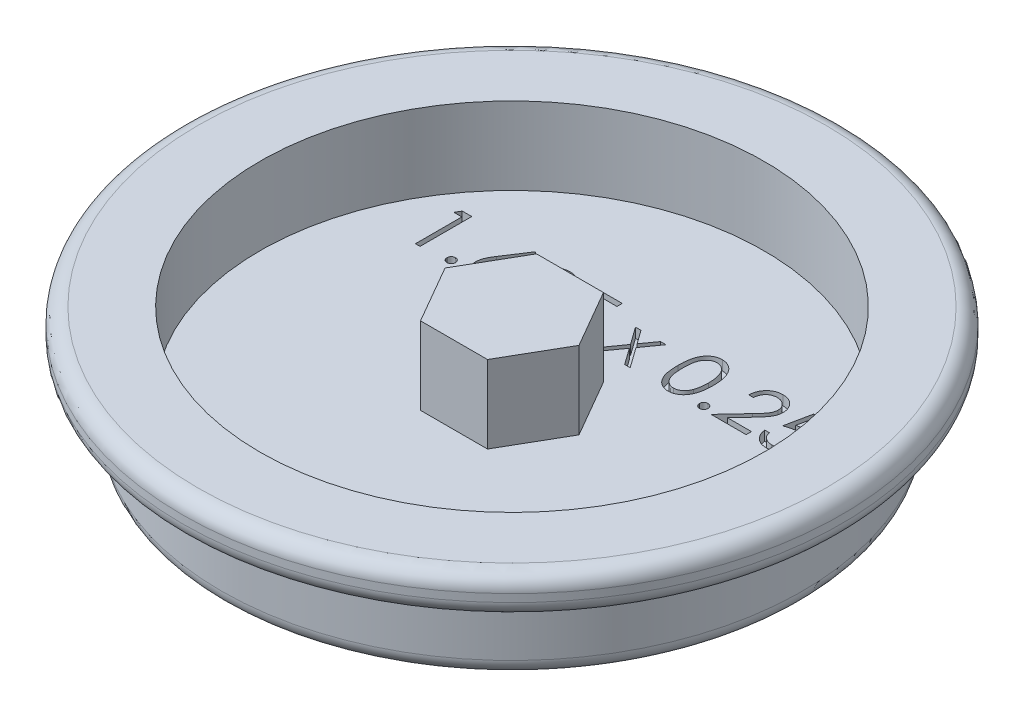
from build123d import *

# Parameters (mm, degrees)
BOSS_EXTRUDE1_DEPTH = 6.35
CUT_EXTRUDE1_DEPTH  = 0.79375


with BuildPart() as part:
    # Sketch1 → Revolve1 (revolve)
    with BuildSketch(Plane.XY):
        with BuildLine():
            Line((0, 0), (22.5425, 0))
            ThreePointArc((22.5425, 0), (23.440525612, 0.371974388), (23.8125, 1.27))
            Line((23.8125, 1.27), (23.8125, 5.08))
            ThreePointArc((23.8125, 5.08), (24.184474388, 5.978025612), (25.0825, 6.35))
            Line((25.0825, 6.35), (25.7175, 6.35))
            ThreePointArc((25.7175, 6.35), (26.615525612, 6.721974388), (26.9875, 7.62))
            Line((26.9875, 7.62), (26.9875, 8.255))
            ThreePointArc((26.9875, 8.255), (26.615525612, 9.153025612), (25.7175, 9.525))
            Line((25.7175, 9.525), (20.6375, 9.525))
            Line((20.6375, 9.525), (20.6375, 3.175))
            Line((20.6375, 3.175), (0, 3.175))
            Line((0, 3.175), (0, 0))
        make_face()
    revolve(axis=Axis((0, 3.175, 0), (0, -1, 0)))

    # Sketch2 → Boss-Extrude1 (add)
    with BuildSketch(Plane(origin=(0, 3.175, 0), x_dir=(1, 0, 0), z_dir=(0, 1, 0))):
        Polygon((2.742298309, 4.7498), (-2.742298309, 4.7498), (-5.484596617, 0), (-2.742298309, -4.7498), (2.742298309, -4.7498), (5.484596617, 0), align=None)
    extrude(amount=BOSS_EXTRUDE1_DEPTH)

    # Sketch3 → Cut-Extrude1 (cut)
    # profile 1 of 10: a face of its own
    with BuildSketch(Plane(origin=(0, 3.175, 0), x_dir=(1, 0, 0), z_dir=(0, 1, 0))):
        Polygon((-15.172196678, 11.095518737), (-14.389470984, 11.095518737), (-14.389470984, 6.862185403), (-14.769385514, 6.862185403), (-14.769385514, 10.661330703), (-15.420667565, 10.661330703), align=None)
    # profile 2 of 10: a face of its own
    with BuildSketch(Plane(origin=(0, 3.175, 0), x_dir=(1, 0, 0), z_dir=(0, 1, 0))):
        with BuildLine():
            add(Edge.make_bspline(
                [(-12.137120557, 7.513467455), (-12.113546681, 7.512066624), (-12.067332854, 7.509320461), (-12.000519813, 7.490480103), (-11.940050081, 7.457026295), (-11.886187271, 7.412439886), (-11.841789914, 7.358379418), (-11.807143888, 7.298391985), (-11.788467649, 7.231019583), (-11.785741489, 7.184537976), (-11.784342779, 7.160689677)],
                knots=[0, 0, 0, 0, 1.020151414, 1.999887582, 2.974338812, 3.990962822, 5.007586832, 5.987933904, 6.967670073, 8, 8, 8, 8], degree=3))
            add(Edge.make_bspline(
                [(-11.784342779, 7.160689677), (-11.785788886, 7.137414411), (-11.788640589, 7.09151593), (-11.807101077, 7.024651684), (-11.842053957, 6.964626762), (-11.885881044, 6.909832747), (-11.940063397, 6.865151885), (-12.000662773, 6.831982696), (-12.067176009, 6.811793349), (-12.113520514, 6.809221542), (-12.137120557, 6.807911899)],
                knots=[0, 0, 0, 0, 1.009421747, 1.99056486, 2.972319754, 3.999869655, 5.017953583, 5.993804169, 6.978383603, 8, 8, 8, 8], degree=3))
            add(Edge.make_bspline(
                [(-12.137120557, 6.807911899), (-12.160737604, 6.809174155), (-12.206844268, 6.811638408), (-12.273109233, 6.832397231), (-12.334077661, 6.864840845), (-12.388249465, 6.909916059), (-12.432443616, 6.964344804), (-12.465857175, 7.025065072), (-12.485923355, 7.091324525), (-12.488562382, 7.137376712), (-12.489898334, 7.160689677)],
                knots=[0, 0, 0, 0, 1.022052826, 1.995314843, 2.982371812, 4.00089066, 5.028879526, 6.005146991, 6.990147033, 8, 8, 8, 8], degree=3))
            add(Edge.make_bspline(
                [(-12.489898334, 7.160689677), (-12.4886137, 7.184577022), (-12.486105609, 7.231214131), (-12.465815049, 7.297978766), (-12.432702868, 7.358658688), (-12.387943962, 7.412357408), (-12.334090766, 7.457336336), (-12.273256308, 7.490071848), (-12.206684674, 7.509473109), (-12.160710749, 7.512112914), (-12.137120557, 7.513467455)],
                knots=[0, 0, 0, 0, 1.032775665, 2.016367738, 2.991239715, 4.008302682, 5.025365648, 6.011011707, 6.979408107, 8, 8, 8, 8], degree=3))
        make_face()
    # profile 3 of 10: a face of its own
    with BuildSketch(Plane(origin=(0, 3.175, 0), x_dir=(1, 0, 0), z_dir=(0, 1, 0))):
        with BuildLine():
            Line((-9.287761582, 11.204065745), (-8.995193473, 10.974251376))
            Line((-8.995193473, 10.974251376), (-10.113736475, 9.263787967))
            add(Edge.make_bspline(
                [(-10.113736475, 9.263787967), (-10.039265759, 9.275658066), (-9.894002208, 9.298812034), (-9.746965359, 9.302631644), (-9.675308324, 9.304493096)],
                knots=[0, 0, 0, 0, 1.025318673, 2, 2, 2, 2], degree=3))
            add(Edge.make_bspline(
                [(-9.675308324, 9.304493096), (-9.632282542, 9.303336656), (-9.547587572, 9.301060238), (-9.423240297, 9.283541676), (-9.303752727, 9.25593416), (-9.18962011, 9.215690574), (-9.080432789, 9.164282964), (-8.975564177, 9.102671188), (-8.876985555, 9.027673841), (-8.783427462, 8.943896228), (-8.698486116, 8.851105209), (-8.623282696, 8.752648354), (-8.560113148, 8.648628241), (-8.508860881, 8.539097555), (-8.469061647, 8.424225137), (-8.440048019, 8.304157958), (-8.422897464, 8.178813226), (-8.420568537, 8.093568195), (-8.419385514, 8.050266333)],
                knots=[0, 0, 0, 0, 1.04369286, 2.054478336, 3.041073146, 4.015093852, 4.984733326, 5.965804835, 6.960378782, 7.985147595, 9.009457201, 10.008161701, 10.986880575, 11.956520048, 12.937015923, 13.931873656, 14.949455224, 16, 16, 16, 16], degree=3))
            add(Edge.make_bspline(
                [(-8.419385514, 8.050266333), (-8.421106793, 7.991024215), (-8.424493863, 7.874449746), (-8.458244169, 7.704660778), (-8.510688692, 7.542908116), (-8.585651988, 7.39177428), (-8.678764013, 7.25146641), (-8.792311197, 7.127144943), (-8.922266654, 7.01626785), (-9.069207829, 6.923549844), (-9.227344557, 6.847829963), (-9.393475068, 6.793443432), (-9.565985997, 6.759959617), (-9.683073476, 6.75576184), (-9.74230218, 6.753638395)],
                knots=[0, 0, 0, 0, 1.031375318, 2.029502543, 3.004789286, 3.987476834, 4.960371455, 5.9300674, 6.912260825, 7.929083631, 8.949397511, 9.960523116, 10.96833055, 12, 12, 12, 12], degree=3))
            add(Edge.make_bspline(
                [(-9.74230218, 6.753638395), (-9.799266761, 6.755486796), (-9.912103622, 6.759148155), (-10.078089954, 6.791764099), (-10.237581413, 6.844628881), (-10.389460569, 6.917459484), (-10.53015312, 7.009453305), (-10.656022985, 7.120200061), (-10.76644256, 7.247332462), (-10.858335673, 7.390830787), (-10.931220044, 7.545032926), (-10.985878334, 7.705823582), (-11.017805219, 7.872616893), (-11.022266616, 7.985684556), (-11.024513719, 8.042634121)],
                knots=[0, 0, 0, 0, 1.012016664, 2.004627821, 2.994792927, 3.992885782, 4.990978636, 5.973936114, 6.964471063, 7.975201453, 8.993600317, 9.990122807, 10.98767138, 12, 12, 12, 12], degree=3))
            add(Edge.make_bspline(
                [(-11.024513719, 8.042634121), (-11.023084733, 8.086230903), (-11.020167017, 8.175247201), (-10.999794535, 8.310065597), (-10.967059022, 8.448013096), (-10.930398057, 8.565039596), (-10.891662319, 8.660908294), (-10.859425438, 8.738201088), (-10.8193007, 8.817740672), (-10.776515753, 8.902254498), (-10.72721935, 8.989564498), (-10.673618517, 9.081129888), (-10.61423132, 9.175494429), (-10.572599313, 9.239531694), (-10.551316604, 9.272268203)],
                knots=[0, 0, 0, 0, 1.173818275, 2.396712641, 3.66331629, 4.989737886, 5.693666774, 6.447286557, 7.243889047, 8.091586357, 8.998013824, 9.943181721, 10.948533338, 12, 12, 12, 12], degree=3))
            Line((-10.551316604, 9.272268203), (-9.287761582, 11.204065745))
        make_face()
        with BuildLine():
            add(Edge.make_bspline(
                [(-9.755022533, 8.870305062), (-9.787271153, 8.869363999), (-9.850262076, 8.867525831), (-9.942678663, 8.856851479), (-10.030143262, 8.836750323), (-10.113814653, 8.811149141), (-10.192128541, 8.775948297), (-10.26565409, 8.733189454), (-10.334675629, 8.682847649), (-10.398470211, 8.62563607), (-10.456309232, 8.562997211), (-10.50611879, 8.495905504), (-10.549083979, 8.425977848), (-10.584017227, 8.352629975), (-10.611219509, 8.275889924), (-10.630896345, 8.196110641), (-10.641847073, 8.112757147), (-10.643668896, 8.056233072), (-10.644599189, 8.027369698)],
                knots=[0, 0, 0, 0, 1.129588631, 2.206414736, 3.251139165, 4.268635594, 5.265702196, 6.250456724, 7.242448911, 8.251968645, 9.246821453, 10.222880186, 11.173611482, 12.116736599, 13.062300278, 14.020270554, 14.989073742, 16, 16, 16, 16], degree=3))
            add(Edge.make_bspline(
                [(-10.644599189, 8.027369698), (-10.64384159, 7.998764485), (-10.642356051, 7.942673919), (-10.628867054, 7.860016054), (-10.608262717, 7.780471831), (-10.577612905, 7.704451326), (-10.541052764, 7.63079578), (-10.492786324, 7.562173101), (-10.439305069, 7.494415492), (-10.375376978, 7.432727998), (-10.30676872, 7.375328082), (-10.233470122, 7.325156727), (-10.157076647, 7.282235356), (-10.076556927, 7.248597171), (-9.993053358, 7.220990653), (-9.905870212, 7.201563911), (-9.814946853, 7.190580799), (-9.753355556, 7.188756603), (-9.721949616, 7.187826429)],
                knots=[0, 0, 0, 0, 0.989467248, 1.94019797, 2.891935182, 3.827694429, 4.772920941, 5.730924762, 6.725747692, 7.756678648, 8.79901574, 9.819492441, 10.826891316, 11.826466727, 12.835195252, 13.867842842, 14.912794438, 16, 16, 16, 16], degree=3))
            add(Edge.make_bspline(
                [(-9.721949616, 7.187826429), (-9.690543728, 7.188756675), (-9.628952532, 7.190581015), (-9.538028442, 7.20156309), (-9.450848, 7.220993664), (-9.367334603, 7.248586253), (-9.286851158, 7.282275857), (-9.210524495, 7.324889703), (-9.137919087, 7.375636626), (-9.06926579, 7.432629906), (-9.005603789, 7.494766594), (-8.950839842, 7.561568258), (-8.90405155, 7.631350398), (-8.866031152, 7.704161179), (-8.835718924, 7.780517798), (-8.815010102, 7.86000374), (-8.801548962, 7.942677143), (-8.800059595, 7.998765573), (-8.799300044, 8.027369698)],
                knots=[0, 0, 0, 0, 1.087397944, 2.132534446, 3.165364764, 4.174271784, 5.174024072, 6.181601208, 7.194203697, 8.236725232, 9.267838612, 10.269026844, 11.221737037, 12.171628256, 13.107553087, 14.05945871, 15.010357665, 16, 16, 16, 16], degree=3))
            add(Edge.make_bspline(
                [(-8.799300044, 8.027369698), (-8.799965636, 8.056270727), (-8.801271978, 8.112994046), (-8.816047458, 8.196073356), (-8.836539663, 8.276295272), (-8.867482948, 8.35315561), (-8.90768334, 8.426351065), (-8.956648985, 8.496251382), (-9.013294094, 8.563392469), (-9.078726356, 8.625758913), (-9.149955496, 8.682784427), (-9.225690537, 8.733124271), (-9.304923991, 8.775608767), (-9.387575521, 8.811056405), (-9.474592151, 8.836637197), (-9.564569037, 8.856779691), (-9.658656978, 8.867498513), (-9.722491543, 8.869357629), (-9.755022533, 8.870305062)],
                knots=[0, 0, 0, 0, 0.978206639, 1.919901502, 2.851605144, 3.780102724, 4.718870031, 5.675451981, 6.667674623, 7.690630536, 8.733308323, 9.756129687, 10.767539656, 11.776269907, 12.797430371, 13.836405707, 14.897401972, 16, 16, 16, 16], degree=3))
        make_face(mode=Mode.SUBTRACT)
    # profile 4 of 10: a face of its own
    with BuildSketch(Plane(origin=(0, 3.175, 0), x_dir=(1, 0, 0), z_dir=(0, 1, 0))):
        with BuildLine():
            Line((-7.442462437, 9.792954634), (-7.822376967, 9.792954634))
            add(Edge.make_bspline(
                [(-7.822376967, 9.792954634), (-7.819900886, 9.843356565), (-7.815037931, 9.942344616), (-7.792264667, 10.086669722), (-7.759679034, 10.224621717), (-7.713606514, 10.355092946), (-7.656388444, 10.479237027), (-7.587772125, 10.596560855), (-7.506499563, 10.706616865), (-7.414325704, 10.808384799), (-7.314215064, 10.901745004), (-7.206197404, 10.982366107), (-7.092689609, 11.050483671), (-6.974036051, 11.107429554), (-6.848898036, 11.150173939), (-6.71841115, 11.181889637), (-6.5820021, 11.200971502), (-6.489062264, 11.203022596), (-6.441794702, 11.204065745)],
                knots=[0, 0, 0, 0, 1.10065271, 2.161652631, 3.183658789, 4.190468796, 5.17591951, 6.163126047, 7.15150782, 8.156236427, 9.156009102, 10.134482811, 11.092018607, 12.041330605, 13.001268258, 13.972401359, 14.968799086, 16, 16, 16, 16], degree=3))
            add(Edge.make_bspline(
                [(-6.441794702, 11.204065745), (-6.395375507, 11.202979041), (-6.304163449, 11.200843705), (-6.171040822, 11.182506079), (-6.044310189, 11.153785221), (-5.924219272, 11.113489432), (-5.811726222, 11.059321601), (-5.705985968, 10.994252197), (-5.605739654, 10.918995829), (-5.515500973, 10.830393598), (-5.43263882, 10.735805952), (-5.361153235, 10.634825344), (-5.299935409, 10.53052897), (-5.248908406, 10.422121527), (-5.211345266, 10.308582283), (-5.182826862, 10.191564237), (-5.166707038, 10.069856133), (-5.16423305, 9.987479632), (-5.162975257, 9.945598865)],
                knots=[0, 0, 0, 0, 1.111607364, 2.184268762, 3.212621178, 4.221274766, 5.211760367, 6.196651075, 7.1921475, 8.207485113, 9.220403448, 10.201281604, 11.166441695, 12.114753415, 13.065576456, 14.026450734, 14.996634279, 16, 16, 16, 16], degree=3))
            add(Edge.make_bspline(
                [(-5.162975257, 9.945598865), (-5.165023299, 9.886637198), (-5.169083442, 9.769748559), (-5.203814165, 9.597978201), (-5.258057087, 9.431555685), (-5.323368176, 9.297616281), (-5.389253894, 9.189686246), (-5.448626403, 9.100824098), (-5.518131461, 9.005144151), (-5.598780691, 8.9029668), (-5.688905784, 8.793491705), (-5.789323068, 8.676785), (-5.900748613, 8.554052478), (-5.978954609, 8.470225703), (-6.019478997, 8.426788769)],
                knots=[0, 0, 0, 0, 1.184426356, 2.348067706, 3.509069118, 4.696110526, 5.333549288, 6.050745305, 6.844228056, 7.710549037, 8.667450064, 9.695053472, 10.805634456, 12, 12, 12, 12], degree=3))
            Line((-6.019478997, 8.426788769), (-7.078660354, 7.296373438))
            Line((-7.078660354, 7.296373438), (-5.108701753, 7.296373438))
            Line((-5.108701753, 7.296373438), (-5.108701753, 6.862185403))
            Line((-5.108701753, 6.862185403), (-7.98519748, 6.862185403))
            Line((-7.98519748, 6.862185403), (-6.343423975, 8.614201963))
            add(Edge.make_bspline(
                [(-6.343423975, 8.614201963), (-6.303451769, 8.655928486), (-6.226673342, 8.736076598), (-6.118079178, 8.853089511), (-6.020544402, 8.961643718), (-5.93343765, 9.061534115), (-5.858648553, 9.15422182), (-5.792279282, 9.236704938), (-5.739101853, 9.31260794), (-5.681388946, 9.400589444), (-5.625492035, 9.508010057), (-5.577458995, 9.639284138), (-5.548170559, 9.77442091), (-5.544657092, 9.865742422), (-5.542889787, 9.911677925)],
                knots=[0, 0, 0, 0, 1.329631726, 2.553950428, 3.673215718, 4.687767853, 5.603093632, 6.413772471, 7.123043292, 7.734684054, 8.834405432, 9.900288307, 10.943827018, 12, 12, 12, 12], degree=3))
            add(Edge.make_bspline(
                [(-5.542889787, 9.911677925), (-5.543658733, 9.940563045), (-5.545174177, 9.997490069), (-5.558548725, 10.080954178), (-5.57876048, 10.161465905), (-5.60772284, 10.239272902), (-5.645951944, 10.313592881), (-5.692486413, 10.384516309), (-5.746177252, 10.453082962), (-5.808287835, 10.517373142), (-5.876518911, 10.576254219), (-5.948599575, 10.628413827), (-6.024860177, 10.67200399), (-6.104979182, 10.707737553), (-6.188733226, 10.735768728), (-6.276284299, 10.755191962), (-6.36739049, 10.767386967), (-6.429600528, 10.769036965), (-6.461299242, 10.769877711)],
                knots=[0, 0, 0, 0, 0.991446411, 1.95395049, 2.89581595, 3.838931463, 4.798493298, 5.75982156, 6.748411868, 7.785213223, 8.824556874, 9.840280684, 10.836137867, 11.835679398, 12.848801643, 13.863922112, 14.911575587, 16, 16, 16, 16], degree=3))
            add(Edge.make_bspline(
                [(-6.461299242, 10.769877711), (-6.494404916, 10.769012863), (-6.559418994, 10.767314443), (-6.654873443, 10.755433697), (-6.745933383, 10.734937299), (-6.832827876, 10.70690456), (-6.915703946, 10.671273744), (-6.994158552, 10.626894205), (-7.06801557, 10.573937027), (-7.137413841, 10.513895593), (-7.201354083, 10.447048113), (-7.257532685, 10.372529396), (-7.306620016, 10.291700046), (-7.349448327, 10.204778161), (-7.384229019, 10.110975017), (-7.410806068, 10.010623603), (-7.431835873, 9.904159646), (-7.438861417, 9.830638639), (-7.442462437, 9.792954634)],
                knots=[0, 0, 0, 0, 1.031018746, 2.02475058, 2.990194455, 3.934040569, 4.864654155, 5.795059489, 6.735614925, 7.690564532, 8.649604399, 9.611025574, 10.590972636, 11.591080095, 12.624614302, 13.701020113, 14.821632451, 16, 16, 16, 16], degree=3))
        make_face()
    # profile 5 of 10: a face of its own
    with BuildSketch(Plane(origin=(0, 3.175, 0), x_dir=(1, 0, 0), z_dir=(0, 1, 0))):
        with BuildLine():
            Line((-2.069385514, 11.095518737), (-2.069385514, 10.661330703))
            Line((-2.069385514, 10.661330703), (-3.509329424, 10.661330703))
            Line((-3.509329424, 10.661330703), (-3.737447747, 9.547875841))
            add(Edge.make_bspline(
                [(-3.737447747, 9.547875841), (-3.692627784, 9.560249599), (-3.605796196, 9.584221797), (-3.477635221, 9.6108383), (-3.355966556, 9.62688317), (-3.277014442, 9.629073993), (-3.238809926, 9.630134121)],
                knots=[0, 0, 0, 0, 1.100273476, 2.13160584, 3.095893838, 4, 4, 4, 4], degree=3))
            add(Edge.make_bspline(
                [(-3.238809926, 9.630134121), (-3.191537212, 9.629110942), (-3.098587246, 9.627099116), (-2.962589663, 9.607780784), (-2.832767973, 9.577373458), (-2.709393677, 9.534894351), (-2.592238535, 9.480574959), (-2.482380437, 9.412720746), (-2.37817039, 9.333456621), (-2.281477919, 9.242325036), (-2.193758042, 9.142029366), (-2.116631559, 9.034190798), (-2.051120616, 8.91985734), (-1.998432846, 8.797936604), (-1.956360366, 8.669776485), (-1.928357477, 8.534028504), (-1.9097106, 8.391972206), (-1.907627333, 8.294841917), (-1.906565001, 8.245311739)],
                knots=[0, 0, 0, 0, 1.052922333, 2.070308379, 3.05430497, 4.020497103, 4.973039431, 5.925935799, 6.892292201, 7.88610001, 8.88166317, 9.857072816, 10.836096531, 11.812156883, 12.81219415, 13.836441305, 14.89672472, 16, 16, 16, 16], degree=3))
            add(Edge.make_bspline(
                [(-1.906565001, 8.245311739), (-1.907369425, 8.210813434), (-1.908967403, 8.14228304), (-1.917093695, 8.040508626), (-1.932739751, 7.940888818), (-1.953746427, 7.843410401), (-1.981012018, 7.748257922), (-2.014018779, 7.655159027), (-2.054412069, 7.564693169), (-2.09871859, 7.476004358), (-2.148607187, 7.391097592), (-2.203977382, 7.31169358), (-2.262476595, 7.236601163), (-2.32542189, 7.166625696), (-2.393398331, 7.102226998), (-2.465582672, 7.043022886), (-2.541398913, 6.988012134), (-2.622020016, 6.939427746), (-2.705649495, 6.89472017), (-2.793495053, 6.85804313), (-2.883557043, 6.8252523), (-2.977131702, 6.799115062), (-3.074007076, 6.778634734), (-3.174342852, 6.764724484), (-3.277612805, 6.754592984), (-3.347614011, 6.753958761), (-3.382973922, 6.753638395)],
                knots=[0, 0, 0, 0, 1.056347294, 2.098418968, 3.122841568, 4.141288669, 5.149314143, 6.15115421, 7.162517403, 8.180376062, 9.185164535, 10.17417709, 11.141909838, 12.097768115, 13.052685741, 14.0056014, 14.954263652, 15.917497458, 16.885230207, 17.854509472, 18.828990115, 19.81800267, 20.826176721, 21.857883937, 22.917946725, 24, 24, 24, 24], degree=3))
            add(Edge.make_bspline(
                [(-3.382973922, 6.753638395), (-3.425155074, 6.75447398), (-3.508141507, 6.756117895), (-3.629723526, 6.773315491), (-3.746702145, 6.797946133), (-3.858135696, 6.835001431), (-3.965022843, 6.881431778), (-4.065924607, 6.940113242), (-4.163419212, 7.006611777), (-4.253543294, 7.085086109), (-4.33718926, 7.170860315), (-4.412066657, 7.263942414), (-4.47875203, 7.36279612), (-4.536177496, 7.467901506), (-4.585160817, 7.578982396), (-4.623641803, 7.696454978), (-4.654700384, 7.819705459), (-4.66783995, 7.9045578), (-4.674513719, 7.947655489)],
                knots=[0, 0, 0, 0, 1.0467383, 2.05933395, 3.04377827, 4.011590433, 4.970194871, 5.932262533, 6.905835911, 7.896367577, 8.894135286, 9.877477877, 10.858688626, 11.851381753, 12.8477658, 13.868841284, 14.917554742, 16, 16, 16, 16], degree=3))
            Line((-4.674513719, 7.947655489), (-4.294599189, 7.947655489))
            add(Edge.make_bspline(
                [(-4.294599189, 7.947655489), (-4.285251315, 7.907285875), (-4.267284182, 7.829693235), (-4.227846752, 7.720677232), (-4.179628027, 7.623529219), (-4.122291339, 7.536964104), (-4.05389273, 7.461478936), (-3.975842849, 7.394208775), (-3.888336556, 7.333520761), (-3.79109903, 7.282935129), (-3.688515592, 7.239792922), (-3.581149538, 7.211064682), (-3.471924281, 7.190864554), (-3.398048538, 7.18884252), (-3.360925311, 7.187826429)],
                knots=[0, 0, 0, 0, 1.136247022, 2.183929868, 3.172523383, 4.106158343, 5.02341133, 5.958108904, 6.928429099, 7.938127109, 8.96079061, 9.975095812, 10.982467395, 12, 12, 12, 12], degree=3))
            add(Edge.make_bspline(
                [(-3.360925311, 7.187826429), (-3.324689859, 7.188819179), (-3.253341958, 7.190773913), (-3.148341519, 7.205819194), (-3.046967852, 7.228990733), (-2.950221239, 7.263667605), (-2.856408711, 7.305813122), (-2.767903293, 7.359897071), (-2.682144575, 7.422139188), (-2.601798166, 7.493448636), (-2.528211403, 7.572031029), (-2.463192095, 7.65606559), (-2.409033352, 7.745711681), (-2.363393049, 7.839417304), (-2.328736202, 7.938209463), (-2.304012348, 8.04162517), (-2.289494363, 8.149919861), (-2.287497221, 8.223784645), (-2.286479531, 8.261424185)],
                knots=[0, 0, 0, 0, 1.027316725, 2.022795036, 3.002884548, 3.971462791, 4.93288096, 5.914575861, 6.907176829, 7.935150275, 8.956128384, 9.956726525, 10.942570165, 11.921478529, 12.907843606, 13.90538589, 14.932640048, 16, 16, 16, 16], degree=3))
            add(Edge.make_bspline(
                [(-2.286479531, 8.261424185), (-2.287275977, 8.295382476), (-2.288834908, 8.361850997), (-2.301571884, 8.459095751), (-2.323726698, 8.551107907), (-2.354477486, 8.63833179), (-2.393520319, 8.720849668), (-2.441231573, 8.798746703), (-2.498506636, 8.870996196), (-2.563932063, 8.937631951), (-2.635606074, 8.999130038), (-2.714761839, 9.051555743), (-2.799742893, 9.095659719), (-2.889525361, 9.133721013), (-2.98624481, 9.161057152), (-3.08798588, 9.181580214), (-3.195847231, 9.193452128), (-3.26959273, 9.195099365), (-3.30749983, 9.195946087)],
                knots=[0, 0, 0, 0, 1.045622112, 2.046656509, 3.013763289, 3.955457236, 4.890082067, 5.820317437, 6.762574623, 7.722996705, 8.69280354, 9.665887285, 10.63943826, 11.638615906, 12.663482002, 13.728887084, 14.832589034, 16, 16, 16, 16], degree=3))
            add(Edge.make_bspline(
                [(-3.30749983, 9.195946087), (-3.340312915, 9.195243848), (-3.408063612, 9.193793903), (-3.511989317, 9.183118045), (-3.621199305, 9.16589528), (-3.735274933, 9.142205247), (-3.854558786, 9.111203849), (-3.978799137, 9.07405393), (-4.108257212, 9.029637798), (-4.195485317, 8.996095025), (-4.240325685, 8.97885207)],
                knots=[0, 0, 0, 0, 0.817624296, 1.688186739, 2.600797293, 3.572016777, 4.590301741, 5.671205678, 6.80286297, 8, 8, 8, 8], degree=3))
            Line((-4.240325685, 8.97885207), (-3.806137651, 11.095518737))
            Line((-3.806137651, 11.095518737), (-2.069385514, 11.095518737))
        make_face()
    # profile 6 of 10: a face of its own
    with BuildSketch(Plane(origin=(0, 3.175, 0), x_dir=(1, 0, 0), z_dir=(0, 1, 0))):
        Polygon((0.155828161, 9.955775147), (0.607824689, 9.955775147), (1.40411876, 8.839776215), (2.20041283, 9.955775147), (2.652409358, 9.955775147), (1.630541035, 8.523463448), (2.815229871, 6.862185403), (2.363233343, 6.862185403), (1.40411876, 8.206302658), (0.445004176, 6.862185403), (-0.006992351, 6.862185403), (1.178544508, 8.523463448), align=None)
    # profile 7 of 10: a face of its own
    with BuildSketch(Plane(origin=(0, 3.175, 0), x_dir=(1, 0, 0), z_dir=(0, 1, 0))):
        with BuildLine():
            add(Edge.make_bspline(
                [(4.606255512, 8.977156023), (4.606652258, 9.045007149), (4.607422942, 9.17680894), (4.615996556, 9.368862745), (4.630239113, 9.549033761), (4.649757649, 9.717330612), (4.673510254, 9.873796747), (4.705218509, 10.018014024), (4.741277804, 10.150649929), (4.78306981, 10.272136978), (4.830226469, 10.384111915), (4.881551718, 10.488645253), (4.939082469, 10.585578829), (4.999530735, 10.676459775), (5.065343431, 10.759800434), (5.134647683, 10.83677775), (5.210148428, 10.905612658), (5.289279114, 10.968321995), (5.372756171, 11.023294213), (5.458200158, 11.071714764), (5.546199191, 11.113080317), (5.636993526, 11.14560494), (5.729767096, 11.172469488), (5.824844215, 11.190840882), (5.922381865, 11.20240019), (5.988217981, 11.203505293), (6.02160674, 11.204065745)],
                knots=[0, 0, 0, 0, 1.646270934, 3.197905019, 4.663502075, 6.030701355, 7.308322542, 8.50163776, 9.611534131, 10.641858119, 11.616356847, 12.558055219, 13.465016945, 14.349605745, 15.204443733, 16.039544428, 16.859896111, 17.680448484, 18.487036065, 19.28249412, 20.06191084, 20.843045899, 21.620316918, 22.403196591, 23.190181807, 24, 24, 24, 24], degree=3))
            add(Edge.make_bspline(
                [(6.02160674, 11.204065745), (6.055274414, 11.203475721), (6.122228825, 11.202302349), (6.221216708, 11.191024818), (6.317917751, 11.172312127), (6.41191969, 11.145798186), (6.503994674, 11.112904368), (6.59342252, 11.071675188), (6.680758704, 11.023682653), (6.764615337, 10.967289963), (6.845913015, 10.904416163), (6.922654837, 10.833341316), (6.994847788, 10.754783084), (7.06339792, 10.669581972), (7.126360404, 10.576103822), (7.186320651, 10.47597447), (7.239989684, 10.367442853), (7.291678292, 10.252319811), (7.33629398, 10.127419957), (7.376530296, 9.993447342), (7.409041048, 9.848819516), (7.436121406, 9.694295295), (7.457100471, 9.529307196), (7.472379952, 9.354208891), (7.480451208, 9.16888518), (7.481971218, 9.042178067), (7.482751238, 8.977156023)],
                knots=[0, 0, 0, 0, 0.810914788, 1.612654377, 2.396697861, 3.181598691, 3.963628158, 4.749916497, 5.551656086, 6.361998678, 7.18212741, 8.025565596, 8.878627764, 9.750805457, 10.657531673, 11.591944965, 12.560506719, 13.57287815, 14.630710178, 15.753379473, 16.941251878, 18.199788006, 19.531962791, 20.947069417, 22.433333509, 24, 24, 24, 24], degree=3))
            add(Edge.make_bspline(
                [(7.482751238, 8.977156023), (7.481963131, 8.912417582), (7.480427537, 8.78627737), (7.472470434, 8.601787523), (7.456796662, 8.427618462), (7.437190295, 8.263352474), (7.41003532, 8.109673258), (7.376646215, 7.966049021), (7.339573919, 7.831859525), (7.293811835, 7.708204086), (7.243724595, 7.593357716), (7.189229262, 7.486112689), (7.130845758, 7.385521078), (7.067238419, 7.292388051), (6.999440481, 7.206053866), (6.92600087, 7.128042455), (6.848989782, 7.056474119), (6.76745286, 6.992790722), (6.682288412, 6.937050053), (6.595252195, 6.88720092), (6.504799912, 6.847005184), (6.412981389, 6.812491373), (6.31848327, 6.786123207), (6.221423349, 6.76789102), (6.122295331, 6.755104117), (6.055285819, 6.754128661), (6.02160674, 6.753638395)],
                knots=[0, 0, 0, 0, 1.561518951, 3.042555995, 4.452378317, 5.7783523, 7.031515105, 8.214008947, 9.334062868, 10.386615937, 11.391082383, 12.354592575, 13.286541444, 14.194233754, 15.072674879, 15.931287219, 16.775624067, 17.606195743, 18.42308326, 19.229000347, 20.022332153, 20.807536673, 21.593273796, 22.3848459, 23.188221202, 24, 24, 24, 24], degree=3))
            add(Edge.make_bspline(
                [(6.02160674, 6.753638395), (5.988218907, 6.754202463), (5.922384617, 6.755314695), (5.824833589, 6.76682178), (5.730149109, 6.785322055), (5.63786395, 6.811225948), (5.547504641, 6.842933416), (5.460302466, 6.88424311), (5.375287839, 6.931818603), (5.292687576, 6.985999731), (5.214053819, 7.048074529), (5.138944077, 7.116732288), (5.069245245, 7.193686319), (5.004373529, 7.277721521), (4.942719156, 7.368064776), (4.886005342, 7.46594957), (4.833547262, 7.570987775), (4.785597516, 7.68385801), (4.74308437, 7.806207304), (4.705531428, 7.939435358), (4.675880971, 8.084718079), (4.650501587, 8.240888609), (4.630031143, 8.40861803), (4.616055911, 8.587997399), (4.607418321, 8.778914938), (4.606650188, 8.909869808), (4.606255512, 8.977156023)],
                knots=[0, 0, 0, 0, 0.810891512, 1.598919785, 2.382837074, 3.152667961, 3.926044502, 4.706494248, 5.493654104, 6.291793342, 7.103789334, 7.925228297, 8.761435821, 9.622817696, 10.50288917, 11.416980706, 12.369136599, 13.353924996, 14.394355917, 15.514179734, 16.714354668, 17.994756427, 19.357759367, 20.818452758, 22.365282078, 24, 24, 24, 24], degree=3))
        make_face()
        with BuildLine():
            add(Edge.make_bspline(
                [(4.986170042, 8.97885207), (4.986314516, 8.922308406), (4.986594912, 8.812568256), (4.99392003, 8.653100693), (5.003898882, 8.504365153), (5.016769785, 8.36617278), (5.035883827, 8.238991336), (5.057300609, 8.1219461), (5.083363536, 8.01565649), (5.114200367, 7.919393138), (5.149323846, 7.83152236), (5.187672843, 7.749757081), (5.228870099, 7.673131405), (5.274976119, 7.602333612), (5.325189576, 7.537132823), (5.37837628, 7.476375016), (5.436521215, 7.422192001), (5.516959076, 7.35720809), (5.623151002, 7.290056376), (5.756949076, 7.23158063), (5.894433774, 7.194832325), (5.987750048, 7.19015902), (6.034327093, 7.187826429)],
                knots=[0, 0, 0, 0, 1.459021318, 2.831673884, 4.118529203, 5.306027144, 6.411944654, 7.436330062, 8.375795394, 9.233974572, 10.042671642, 10.816086306, 11.563610507, 12.285937304, 12.993564865, 13.685989202, 14.367179055, 15.041617293, 16.353048772, 17.594441528, 18.799311195, 20, 20, 20, 20], degree=3))
            add(Edge.make_bspline(
                [(6.034327093, 7.187826429), (6.08120542, 7.189758983), (6.174865287, 7.193620101), (6.311703306, 7.230871907), (6.444545632, 7.287077921), (6.548651693, 7.353538237), (6.627854389, 7.416830598), (6.684601606, 7.470793077), (6.736686178, 7.531215888), (6.78608564, 7.59640837), (6.831393284, 7.667616041), (6.87259346, 7.744496489), (6.910189509, 7.827263209), (6.931609022, 7.885041846), (6.942560266, 7.914582572)],
                knots=[0, 0, 0, 0, 1.353760809, 2.704726607, 4.075137775, 5.516104923, 6.260822281, 7.007110065, 7.778089737, 8.566572457, 9.372053459, 10.217411131, 11.088608312, 12, 12, 12, 12], degree=3))
            add(Edge.make_bspline(
                [(6.942560266, 7.914582572), (6.95532288, 7.952355686), (6.981236461, 8.029051305), (7.014633559, 8.148024484), (7.040935138, 8.272850685), (7.064597494, 8.402783921), (7.080748333, 8.538782417), (7.093748069, 8.680425376), (7.101405186, 8.827819595), (7.102354361, 8.927962108), (7.102836708, 8.97885207)],
                knots=[0, 0, 0, 0, 0.884706709, 1.796334032, 2.740027952, 3.714592787, 4.726048262, 5.777819803, 6.87074269, 8, 8, 8, 8], degree=3))
            add(Edge.make_bspline(
                [(7.102836708, 8.97885207), (7.102171241, 9.029733801), (7.100869446, 9.129269343), (7.09589348, 9.275038952), (7.083044013, 9.413490434), (7.068772698, 9.545220244), (7.047730345, 9.669499181), (7.025042331, 9.787367646), (6.994560865, 9.8973654), (6.962000756, 10.001214608), (6.924734849, 10.0977354), (6.883712961, 10.187377789), (6.839901881, 10.270574551), (6.792316505, 10.347097423), (6.741521726, 10.417289166), (6.686176881, 10.479742437), (6.628477306, 10.536392865), (6.547660329, 10.601057116), (6.441858093, 10.666990309), (6.310206691, 10.72766699), (6.17320315, 10.762511306), (6.080585734, 10.767424013), (6.034327093, 10.769877711)],
                knots=[0, 0, 0, 0, 1.31362396, 2.569729283, 3.763502607, 4.902122613, 5.988968491, 7.01645872, 7.998833611, 8.933434873, 9.825090667, 10.667526885, 11.477055099, 12.250526234, 12.991942729, 13.710640831, 14.402115721, 15.076753259, 16.378508321, 17.609869233, 18.806226677, 20, 20, 20, 20], degree=3))
            add(Edge.make_bspline(
                [(6.034327093, 10.769877711), (5.98750571, 10.767420628), (5.893777647, 10.762501986), (5.755350121, 10.727796812), (5.622660096, 10.667304939), (5.517137641, 10.600838736), (5.436264299, 10.537534302), (5.37931666, 10.482638306), (5.325920814, 10.422589979), (5.276732262, 10.356789568), (5.230662367, 10.286074314), (5.188352, 10.209887903), (5.150231039, 10.127844253), (5.1150526, 10.040012945), (5.084121704, 9.943757898), (5.058608053, 9.837599211), (5.035037999, 9.720926256), (5.018352292, 9.593055994), (5.003518988, 9.454829009), (4.99398631, 9.305722157), (4.986570408, 9.145987144), (4.98630617, 9.035679591), (4.986170042, 8.97885207)],
                knots=[0, 0, 0, 0, 1.207732386, 2.417664972, 3.655092373, 4.956220595, 5.625982001, 6.301752483, 6.994047911, 7.697131622, 8.419323945, 9.170223765, 9.943494443, 10.752040957, 11.610060368, 12.549350801, 13.567764191, 14.679664412, 15.874934091, 17.154273443, 18.533957287, 20, 20, 20, 20], degree=3))
        make_face(mode=Mode.SUBTRACT)
    # profile 8 of 10: a face of its own
    with BuildSketch(Plane(origin=(0, 3.175, 0), x_dir=(1, 0, 0), z_dir=(0, 1, 0))):
        with BuildLine():
            add(Edge.make_bspline(
                [(8.541084572, 7.513467455), (8.564658447, 7.512066624), (8.610872275, 7.509320461), (8.677685316, 7.490480103), (8.738155047, 7.457026295), (8.792017857, 7.412439886), (8.836415214, 7.358379418), (8.87106124, 7.298391985), (8.88973748, 7.231019583), (8.89246364, 7.184537976), (8.893862349, 7.160689677)],
                knots=[0, 0, 0, 0, 1.020151414, 1.999887582, 2.974338812, 3.990962822, 5.007586832, 5.987933904, 6.967670073, 8, 8, 8, 8], degree=3))
            add(Edge.make_bspline(
                [(8.893862349, 7.160689677), (8.892416242, 7.137414411), (8.889564539, 7.09151593), (8.871104051, 7.024651684), (8.836151171, 6.964626762), (8.792324085, 6.909832747), (8.738141732, 6.865151885), (8.677542355, 6.831982696), (8.611029119, 6.811793349), (8.564684614, 6.809221542), (8.541084572, 6.807911899)],
                knots=[0, 0, 0, 0, 1.009421747, 1.99056486, 2.972319754, 3.999869655, 5.017953583, 5.993804169, 6.978383603, 8, 8, 8, 8], degree=3))
            add(Edge.make_bspline(
                [(8.541084572, 6.807911899), (8.517467524, 6.809174155), (8.47136086, 6.811638408), (8.405095896, 6.832397231), (8.344127467, 6.864840845), (8.289955663, 6.909916059), (8.245761512, 6.964344804), (8.212347954, 7.025065072), (8.192281773, 7.091324525), (8.189642747, 7.137376712), (8.188306794, 7.160689677)],
                knots=[0, 0, 0, 0, 1.022052826, 1.995314843, 2.982371812, 4.00089066, 5.028879526, 6.005146991, 6.990147033, 8, 8, 8, 8], degree=3))
            add(Edge.make_bspline(
                [(8.188306794, 7.160689677), (8.189591428, 7.184577022), (8.192099519, 7.231214131), (8.21239008, 7.297978766), (8.24550226, 7.358658688), (8.290261166, 7.412357408), (8.344114362, 7.457336336), (8.40494882, 7.490071848), (8.471520454, 7.509473109), (8.51749438, 7.512112914), (8.541084572, 7.513467455)],
                knots=[0, 0, 0, 0, 1.032775665, 2.016367738, 2.991239715, 4.008302682, 5.025365648, 6.011011707, 6.979408107, 8, 8, 8, 8], degree=3))
        make_face()
    # profile 9 of 10: a face of its own
    with BuildSketch(Plane(origin=(0, 3.175, 0), x_dir=(1, 0, 0), z_dir=(0, 1, 0))):
        with BuildLine():
            Line((9.979332435, 9.792954634), (9.599417905, 9.792954634))
            add(Edge.make_bspline(
                [(9.599417905, 9.792954634), (9.601893985, 9.843356565), (9.606756941, 9.942344616), (9.629530205, 10.086669722), (9.662115838, 10.224621717), (9.708188358, 10.355092946), (9.765406428, 10.479237027), (9.834022746, 10.596560855), (9.915295308, 10.706616865), (10.007469168, 10.808384799), (10.107579807, 10.901745004), (10.215597467, 10.982366107), (10.329105262, 11.050483671), (10.447758821, 11.107429554), (10.572896836, 11.150173939), (10.703383721, 11.181889637), (10.839792772, 11.200971502), (10.932732608, 11.203022596), (10.98000017, 11.204065745)],
                knots=[0, 0, 0, 0, 1.10065271, 2.161652631, 3.183658789, 4.190468796, 5.17591951, 6.163126047, 7.15150782, 8.156236427, 9.156009102, 10.134482811, 11.092018607, 12.041330605, 13.001268258, 13.972401359, 14.968799086, 16, 16, 16, 16], degree=3))
            add(Edge.make_bspline(
                [(10.98000017, 11.204065745), (11.026419364, 11.202979041), (11.117631423, 11.200843705), (11.25075405, 11.182506079), (11.377484682, 11.153785221), (11.4975756, 11.113489432), (11.61006865, 11.059321601), (11.715808903, 10.994252197), (11.816055217, 10.918995829), (11.906293899, 10.830393598), (11.989156052, 10.735805952), (12.060641636, 10.634825344), (12.121859463, 10.53052897), (12.172886466, 10.422121527), (12.210449605, 10.308582283), (12.238968009, 10.191564237), (12.255087834, 10.069856133), (12.257561822, 9.987479632), (12.258819614, 9.945598865)],
                knots=[0, 0, 0, 0, 1.111607364, 2.184268762, 3.212621178, 4.221274766, 5.211760367, 6.196651075, 7.1921475, 8.207485113, 9.220403448, 10.201281604, 11.166441695, 12.114753415, 13.065576456, 14.026450734, 14.996634279, 16, 16, 16, 16], degree=3))
            add(Edge.make_bspline(
                [(12.258819614, 9.945598865), (12.256771573, 9.886637198), (12.252711429, 9.769748559), (12.217980707, 9.597978201), (12.163737784, 9.431555685), (12.098426696, 9.297616281), (12.032540978, 9.189686246), (11.973168468, 9.100824098), (11.903663411, 9.005144151), (11.82301418, 8.9029668), (11.732889087, 8.793491705), (11.632471804, 8.676785), (11.521046259, 8.554052478), (11.442840263, 8.470225703), (11.402315875, 8.426788769)],
                knots=[0, 0, 0, 0, 1.184426356, 2.348067706, 3.509069118, 4.696110526, 5.333549288, 6.050745305, 6.844228056, 7.710549037, 8.667450064, 9.695053472, 10.805634456, 12, 12, 12, 12], degree=3))
            Line((11.402315875, 8.426788769), (10.343134518, 7.296373438))
            Line((10.343134518, 7.296373438), (12.313093119, 7.296373438))
            Line((12.313093119, 7.296373438), (12.313093119, 6.862185403))
            Line((12.313093119, 6.862185403), (9.436597392, 6.862185403))
            Line((9.436597392, 6.862185403), (11.078370896, 8.614201963))
            add(Edge.make_bspline(
                [(11.078370896, 8.614201963), (11.118343102, 8.655928486), (11.195121529, 8.736076598), (11.303715694, 8.853089511), (11.40125047, 8.961643718), (11.488357221, 9.061534115), (11.563146318, 9.15422182), (11.629515589, 9.236704938), (11.682693019, 9.31260794), (11.740405926, 9.400589444), (11.796302836, 9.508010057), (11.844335877, 9.639284138), (11.873624312, 9.77442091), (11.87713778, 9.865742422), (11.878905084, 9.911677925)],
                knots=[0, 0, 0, 0, 1.329631726, 2.553950428, 3.673215718, 4.687767853, 5.603093632, 6.413772471, 7.123043292, 7.734684054, 8.834405432, 9.900288307, 10.943827018, 12, 12, 12, 12], degree=3))
            add(Edge.make_bspline(
                [(11.878905084, 9.911677925), (11.878136139, 9.940563045), (11.876620695, 9.997490069), (11.863246147, 10.080954178), (11.843034392, 10.161465905), (11.814072032, 10.239272902), (11.775842927, 10.313592881), (11.729308458, 10.384516309), (11.67561762, 10.453082962), (11.613507037, 10.517373142), (11.545275961, 10.576254219), (11.473195297, 10.628413827), (11.396934694, 10.67200399), (11.31681569, 10.707737553), (11.233061646, 10.735768728), (11.145510573, 10.755191962), (11.054404382, 10.767386967), (10.992194344, 10.769036965), (10.960495629, 10.769877711)],
                knots=[0, 0, 0, 0, 0.991446411, 1.95395049, 2.89581595, 3.838931463, 4.798493298, 5.75982156, 6.748411868, 7.785213223, 8.824556874, 9.840280684, 10.836137867, 11.835679398, 12.848801643, 13.863922112, 14.911575587, 16, 16, 16, 16], degree=3))
            add(Edge.make_bspline(
                [(10.960495629, 10.769877711), (10.927389955, 10.769012863), (10.862375878, 10.767314443), (10.766921429, 10.755433697), (10.675861488, 10.734937299), (10.588966996, 10.70690456), (10.506090926, 10.671273744), (10.42763632, 10.626894205), (10.353779302, 10.573937027), (10.284381031, 10.513895593), (10.220440789, 10.447048113), (10.164262187, 10.372529396), (10.115174856, 10.291700046), (10.072346545, 10.204778161), (10.037565853, 10.110975017), (10.010988804, 10.010623603), (9.989958999, 9.904159646), (9.982933455, 9.830638639), (9.979332435, 9.792954634)],
                knots=[0, 0, 0, 0, 1.031018746, 2.02475058, 2.990194455, 3.934040569, 4.864654155, 5.795059489, 6.735614925, 7.690564532, 8.649604399, 9.611025574, 10.590972636, 11.591080095, 12.624614302, 13.701020113, 14.821632451, 16, 16, 16, 16], degree=3))
        make_face()
    # profile 10 of 10: a face of its own
    with BuildSketch(Plane(origin=(0, 3.175, 0), x_dir=(1, 0, 0), z_dir=(0, 1, 0))):
        with BuildLine():
            Line((15.352409358, 11.095518737), (15.352409358, 10.661330703))
            Line((15.352409358, 10.661330703), (13.912465448, 10.661330703))
            Line((13.912465448, 10.661330703), (13.684347125, 9.547875841))
            add(Edge.make_bspline(
                [(13.684347125, 9.547875841), (13.729167087, 9.560249599), (13.815998676, 9.584221797), (13.94415965, 9.6108383), (14.065828316, 9.62688317), (14.14478043, 9.629073993), (14.182984946, 9.630134121)],
                knots=[0, 0, 0, 0, 1.100273476, 2.13160584, 3.095893838, 4, 4, 4, 4], degree=3))
            add(Edge.make_bspline(
                [(14.182984946, 9.630134121), (14.230257659, 9.629110942), (14.323207626, 9.627099116), (14.459205209, 9.607780784), (14.589026899, 9.577373458), (14.712401194, 9.534894351), (14.829556337, 9.480574959), (14.939414435, 9.412720746), (15.043624482, 9.333456621), (15.140316953, 9.242325036), (15.22803683, 9.142029366), (15.305163313, 9.034190798), (15.370674255, 8.91985734), (15.423362026, 8.797936604), (15.465434506, 8.669776485), (15.493437395, 8.534028504), (15.512084272, 8.391972206), (15.514167539, 8.294841917), (15.515229871, 8.245311739)],
                knots=[0, 0, 0, 0, 1.052922333, 2.070308379, 3.05430497, 4.020497103, 4.973039431, 5.925935799, 6.892292201, 7.88610001, 8.88166317, 9.857072816, 10.836096531, 11.812156883, 12.81219415, 13.836441305, 14.89672472, 16, 16, 16, 16], degree=3))
            add(Edge.make_bspline(
                [(15.515229871, 8.245311739), (15.514425446, 8.210813434), (15.512827469, 8.14228304), (15.504701177, 8.040508626), (15.48905512, 7.940888818), (15.468048445, 7.843410401), (15.440782853, 7.748257922), (15.407776093, 7.655159027), (15.367382803, 7.564693169), (15.323076282, 7.476004358), (15.273187685, 7.391097592), (15.21781749, 7.31169358), (15.159318277, 7.236601163), (15.096372982, 7.166625696), (15.02839654, 7.102226998), (14.9562122, 7.043022886), (14.880395958, 6.988012134), (14.799774856, 6.939427746), (14.716145376, 6.89472017), (14.628299819, 6.85804313), (14.538237829, 6.8252523), (14.444663169, 6.799115062), (14.347787796, 6.778634734), (14.24745202, 6.764724484), (14.144182067, 6.754592984), (14.074180861, 6.753958761), (14.03882095, 6.753638395)],
                knots=[0, 0, 0, 0, 1.056347294, 2.098418968, 3.122841568, 4.141288669, 5.149314143, 6.15115421, 7.162517403, 8.180376062, 9.185164535, 10.17417709, 11.141909838, 12.097768115, 13.052685741, 14.0056014, 14.954263652, 15.917497458, 16.885230207, 17.854509472, 18.828990115, 19.81800267, 20.826176721, 21.857883937, 22.917946725, 24, 24, 24, 24], degree=3))
            add(Edge.make_bspline(
                [(14.03882095, 6.753638395), (13.996639798, 6.75447398), (13.913653365, 6.756117895), (13.792071345, 6.773315491), (13.675092727, 6.797946133), (13.563659176, 6.835001431), (13.456772029, 6.881431778), (13.355870265, 6.940113242), (13.25837566, 7.006611777), (13.168251577, 7.085086109), (13.084605612, 7.170860315), (13.009728215, 7.263942414), (12.943042841, 7.36279612), (12.885617376, 7.467901506), (12.836634055, 7.578982396), (12.798153069, 7.696454978), (12.767094487, 7.819705459), (12.753954922, 7.9045578), (12.747281153, 7.947655489)],
                knots=[0, 0, 0, 0, 1.0467383, 2.05933395, 3.04377827, 4.011590433, 4.970194871, 5.932262533, 6.905835911, 7.896367577, 8.894135286, 9.877477877, 10.858688626, 11.851381753, 12.8477658, 13.868841284, 14.917554742, 16, 16, 16, 16], degree=3))
            Line((12.747281153, 7.947655489), (13.127195683, 7.947655489))
            add(Edge.make_bspline(
                [(13.127195683, 7.947655489), (13.136543557, 7.907285875), (13.15451069, 7.829693235), (13.19394812, 7.720677232), (13.242166845, 7.623529219), (13.299503533, 7.536964104), (13.367902142, 7.461478936), (13.445952022, 7.394208775), (13.533458316, 7.333520761), (13.630695841, 7.282935129), (13.73327928, 7.239792922), (13.840645334, 7.211064682), (13.949870591, 7.190864554), (14.023746334, 7.18884252), (14.060869561, 7.187826429)],
                knots=[0, 0, 0, 0, 1.136247022, 2.183929868, 3.172523383, 4.106158343, 5.02341133, 5.958108904, 6.928429099, 7.938127109, 8.96079061, 9.975095812, 10.982467395, 12, 12, 12, 12], degree=3))
            add(Edge.make_bspline(
                [(14.060869561, 7.187826429), (14.097105013, 7.188819179), (14.168452914, 7.190773913), (14.273453353, 7.205819194), (14.37482702, 7.228990733), (14.471573632, 7.263667605), (14.565386161, 7.305813122), (14.653891579, 7.359897071), (14.739650297, 7.422139188), (14.819996706, 7.493448636), (14.893583468, 7.572031029), (14.958602777, 7.65606559), (15.01276152, 7.745711681), (15.058401823, 7.839417304), (15.09305867, 7.938209463), (15.117782523, 8.04162517), (15.132300509, 8.149919861), (15.13429765, 8.223784645), (15.135315341, 8.261424185)],
                knots=[0, 0, 0, 0, 1.027316725, 2.022795036, 3.002884548, 3.971462791, 4.93288096, 5.914575861, 6.907176829, 7.935150275, 8.956128384, 9.956726525, 10.942570165, 11.921478529, 12.907843606, 13.90538589, 14.932640048, 16, 16, 16, 16], degree=3))
            add(Edge.make_bspline(
                [(15.135315341, 8.261424185), (15.134518894, 8.295382476), (15.132959963, 8.361850997), (15.120222988, 8.459095751), (15.098068174, 8.551107907), (15.067317386, 8.63833179), (15.028274552, 8.720849668), (14.980563299, 8.798746703), (14.923288236, 8.870996196), (14.857862809, 8.937631951), (14.786188798, 8.999130038), (14.707033033, 9.051555743), (14.622051978, 9.095659719), (14.532269511, 9.133721013), (14.435550062, 9.161057152), (14.333808992, 9.181580214), (14.225947641, 9.193452128), (14.152202142, 9.195099365), (14.114295042, 9.195946087)],
                knots=[0, 0, 0, 0, 1.045622112, 2.046656509, 3.013763289, 3.955457236, 4.890082067, 5.820317437, 6.762574623, 7.722996705, 8.69280354, 9.665887285, 10.63943826, 11.638615906, 12.663482002, 13.728887084, 14.832589034, 16, 16, 16, 16], degree=3))
            add(Edge.make_bspline(
                [(14.114295042, 9.195946087), (14.081481956, 9.195243848), (14.01373126, 9.193793903), (13.909805555, 9.183118045), (13.800595567, 9.16589528), (13.686519939, 9.142205247), (13.567236086, 9.111203849), (13.442995735, 9.07405393), (13.31353766, 9.029637798), (13.226309555, 8.996095025), (13.181469187, 8.97885207)],
                knots=[0, 0, 0, 0, 0.817624296, 1.688186739, 2.600797293, 3.572016777, 4.590301741, 5.671205678, 6.80286297, 8, 8, 8, 8], degree=3))
            Line((13.181469187, 8.97885207), (13.615657221, 11.095518737))
            Line((13.615657221, 11.095518737), (15.352409358, 11.095518737))
        make_face()
    extrude(amount=-CUT_EXTRUDE1_DEPTH, mode=Mode.SUBTRACT)


solid = part.part
